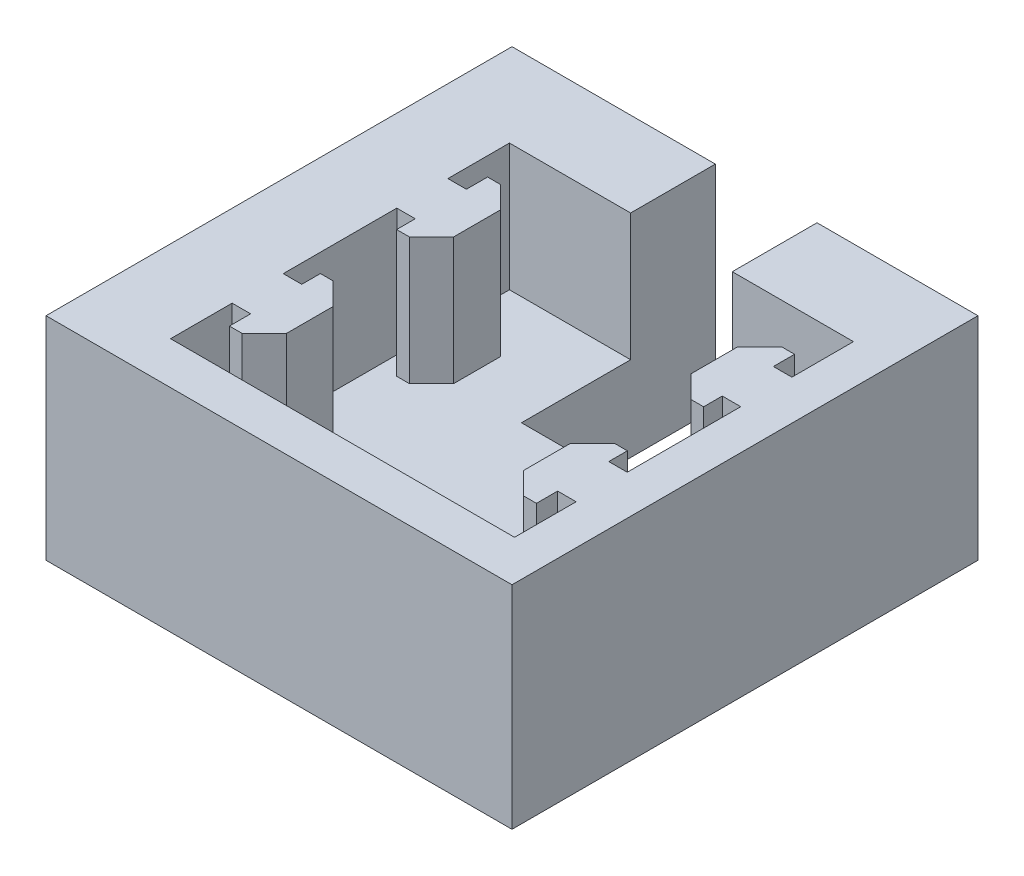
from build123d import *

# Parameters (mm, degrees)
SKETCH1_W           = 55
SKETCH1_H           = 55
BOSS_EXTRUDE1_DEPTH = 10
BOSS_EXTRUDE3_DEPTH = 15
SKETCH3_W           = 55
SKETCH3_H           = 55
SKETCH3_W_2         = 40.6
SKETCH3_H_2         = 40
BOSS_EXTRUDE5_DEPTH = 15
SKETCH7_W           = 12
SKETCH7_H           = 22.88370491
CUT_EXTRUDE3_DEPTH  = 45
SKETCH8_R           = 2
CUT_EXTRUDE4_DEPTH  = 7


with BuildPart() as part:
    # Sketch1 → Boss-Extrude1 (new body)
    with BuildSketch(Plane(origin=(0, 0, 0), x_dir=(1, 0, 0), z_dir=(0, 1, 0))):
        with Locations((-27.5, -27.5)):
            Rectangle(SKETCH1_W, SKETCH1_H)
    extrude(amount=BOSS_EXTRUDE1_DEPTH)

    # Sketch2 → Boss-Extrude3 (add)
    with BuildSketch(Plane(origin=(0, 10, 0), x_dir=(1, 0, 0), z_dir=(0, 1, 0))):
        Polygon((-45.31629509, -17.267409819), (-43.11629509, -17.267409819), (-43.11629509, -14.767409819), (-41.61629509, -14.767409819), (-39, -17.38370491), (-39, -22.88370491), (-41.61629509, -25.5), (-43.11629509, -25.5), (-43.11629509, -23.3), (-45.31629509, -23.3), align=None)
        Polygon((-6.88370491, -23.3), (-4.68370491, -23.3), (-4.68370491, -17.267409819), (-6.88370491, -17.267409819), (-6.88370491, -14.767409819), (-8.38370491, -14.767409819), (-11, -17.38370491), (-11, -22.88370491), (-8.38370491, -25.5), (-6.88370491, -25.5), align=None)
        Polygon((-43.11629509, -36.7), (-45.31629509, -36.7), (-45.31629509, -42.732590181), (-43.11629509, -42.732590181), (-43.11629509, -45.232590181), (-41.61629509, -45.232590181), (-39, -42.61629509), (-39, -37.11629509), (-41.61629509, -34.5), (-43.11629509, -34.5), align=None)
        Polygon((-6.88370491, -34.5), (-6.88370491, -36.7), (-4.68370491, -36.7), (-4.68370491, -42.732590181), (-6.88370491, -42.732590181), (-6.88370491, -45.232590181), (-8.38370491, -45.232590181), (-11, -42.61629509), (-11, -37.11629509), (-8.38370491, -34.5), align=None)
    extrude(amount=BOSS_EXTRUDE3_DEPTH)

    # Sketch3 → Boss-Extrude5 (add)
    with BuildSketch(Plane(origin=(0, 10, 0), x_dir=(1, 0, 0), z_dir=(0, 1, 0))):
        with Locations((-27.5, -27.5)):
            Rectangle(SKETCH3_W, SKETCH3_H)
        with Locations((-25, -30)):
            Rectangle(SKETCH3_W_2, SKETCH3_H_2, mode=Mode.SUBTRACT)
    extrude(amount=BOSS_EXTRUDE5_DEPTH)

    # Sketch7 → Cut-Extrude3 (cut)
    with BuildSketch(Plane(origin=(0, 25, 0), x_dir=(1, 0, 0), z_dir=(0, 1, 0))):
        with Locations((-25, -11.441852455)):
            Rectangle(SKETCH7_W, SKETCH7_H)
    extrude(amount=-CUT_EXTRUDE3_DEPTH, mode=Mode.SUBTRACT)

    # Sketch8 → Cut-Extrude4 (cut)
    with BuildSketch(Plane(origin=(0, 0, 0), x_dir=(-1, 0, 0), z_dir=(0, 0, -1))):
        with Locations((50, 9)):
            Circle(SKETCH8_R)
    extrude(amount=-CUT_EXTRUDE4_DEPTH, mode=Mode.SUBTRACT)


solid = part.part
